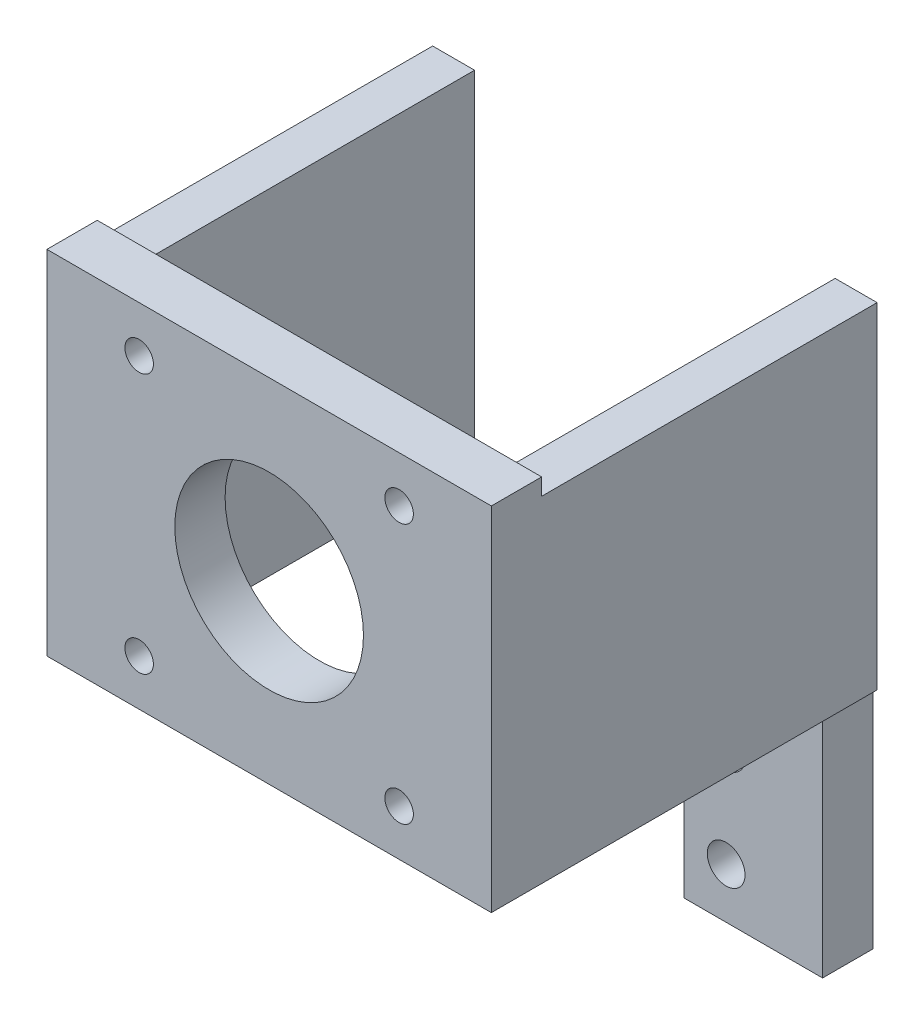
from build123d import *

# Parameters (mm, degrees)
EXTRUDE_START               = 40
SKETCH_2095_W               = 53
SKETCH_2095_H               = 42
EXTRUDE_2102_DEPTH          = 6
SKETCH_2154_W               = 5
SKETCH_2154_H               = 40
EXTRUDE_2161_DEPTH          = 40
EXTRUDE_2219_DEPTH          = 6
CUT_EXTRUDE_2277_DEPTH      = 72.569895906
CUT_EXTRUDE_2277_DEPTH_BACK = 72.569895906
SKETCH_2268_R               = 11.25
SKETCH_2268_R_2             = 1.7
CUT_EXTRUDE_2323_DEPTH      = 72.569895906
CUT_EXTRUDE_2323_DEPTH_BACK = 72.569895906
SKETCH_2315_R               = 2.25


with BuildPart() as part:
    # Sketch 2095 → Extrude 2102 (new body)
    with BuildSketch(Plane.XY.offset(EXTRUDE_START)):
        Rectangle(SKETCH_2095_W, SKETCH_2095_H)
    extrude(amount=EXTRUDE_2102_DEPTH)

    # Sketch 2154 → Extrude 2161 (add)
    with BuildSketch(Plane.XY):
        with Locations((-24, -1)):
            Rectangle(SKETCH_2154_W, SKETCH_2154_H)
        with Locations((24, -1)):
            Rectangle(SKETCH_2154_W, SKETCH_2154_H)
    extrude(amount=EXTRUDE_2161_DEPTH)

    # Sketch 2213 → Extrude 2219 (add)
    with BuildSketch(Plane.XY):
        Polygon((-21.5, -18), (-26.5, -18), (-26.5, -21), (-26, -21), (-26, -48), (-9.5, -48), (-9.5, -21), (-21.5, -21), align=None)
        Polygon((21.5, -18), (26.5, -18), (26.5, -21), (26, -21), (26, -48), (9.5, -48), (9.5, -21), (21.5, -21), align=None)
    extrude(amount=EXTRUDE_2219_DEPTH)

    # Sketch 2268 → Cut-Extrude 2277 (cut, two sides: drawn at the far end of the back side and taken through both)
    with BuildSketch(Plane.XY.offset(-CUT_EXTRUDE_2277_DEPTH_BACK)):
        Circle(SKETCH_2268_R)
        with Locations((-15.5, -15.5)):
            Circle(SKETCH_2268_R_2)
        with Locations((-15.5, 15.5)):
            Circle(SKETCH_2268_R_2)
        with Locations((15.5, -15.5)):
            Circle(SKETCH_2268_R_2)
        with Locations((15.5, 15.5)):
            Circle(SKETCH_2268_R_2)
    extrude(amount=CUT_EXTRUDE_2277_DEPTH + CUT_EXTRUDE_2277_DEPTH_BACK, mode=Mode.SUBTRACT)

    # Sketch 2315 → Cut-Extrude 2323 (cut, two sides: drawn at the far end of the back side and taken through both)
    with BuildSketch(Plane.XY.offset(-CUT_EXTRUDE_2323_DEPTH_BACK)):
        with Locations((-14.5, -30)):
            Circle(SKETCH_2315_R)
        with Locations((-14.5, -42)):
            Circle(SKETCH_2315_R)
        with Locations((14.5, -30)):
            Circle(SKETCH_2315_R)
        with Locations((14.5, -42)):
            Circle(SKETCH_2315_R)
    extrude(amount=CUT_EXTRUDE_2323_DEPTH + CUT_EXTRUDE_2323_DEPTH_BACK, mode=Mode.SUBTRACT)


solid = part.part
